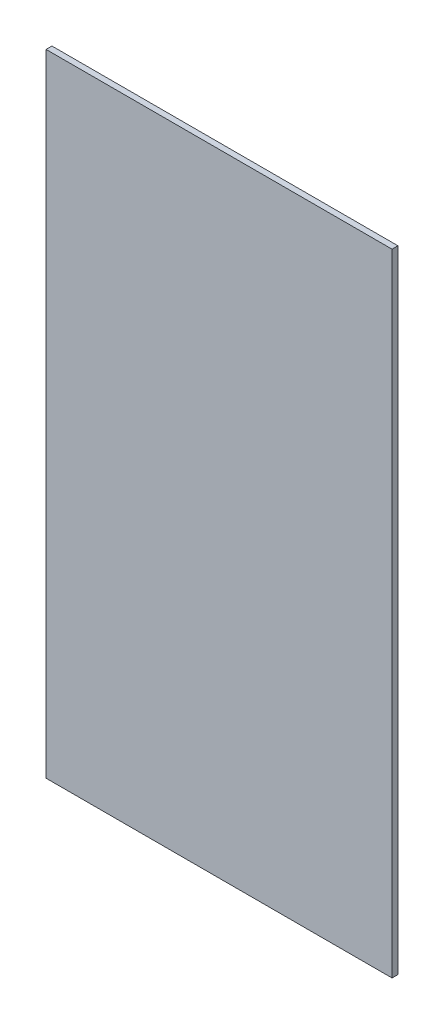
from build123d import *

# Parameters (mm, degrees)
SKETCH1_W           = 149.111686737
SKETCH1_H           = 272.0183
BOSS_EXTRUDE1_DEPTH = 2.54


with BuildPart() as part:
    # Sketch1 → Boss-Extrude1 (new body)
    with BuildSketch(Plane.XY):
        with Locations((-25.343343369, -161.85665)):
            Rectangle(SKETCH1_W, SKETCH1_H)
    extrude(amount=BOSS_EXTRUDE1_DEPTH)


solid = part.part
